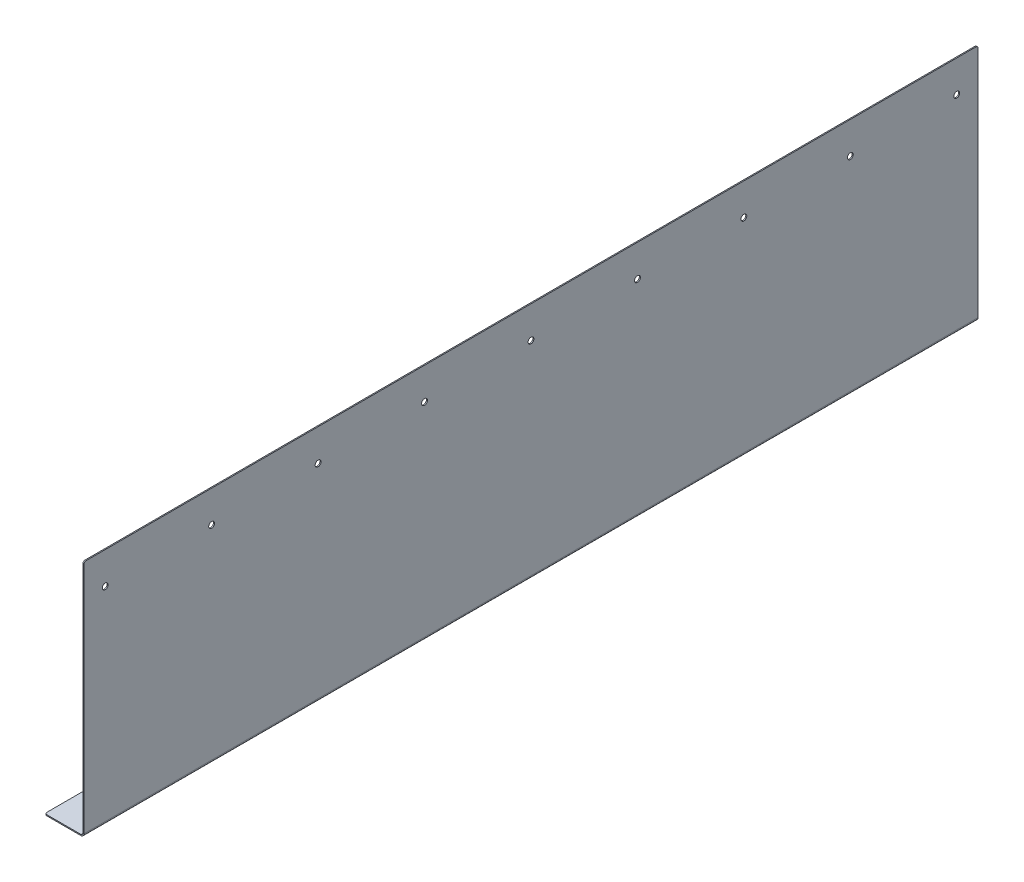
from build123d import *

# Parameters (mm, degrees)
SKETCH2_W                    = 1
SKETCH2_H                    = 225
BASE_FLANGE1_DEPTH           = 421.5
EDGE_FLANGE1_STRIP_W         = 8
EDGE_FLANGE1_STRIP_H         = 1
EDGE_FLANGE1_STRIP_CUT_DEPTH = 843
EDGE_FLANGE1_DEPTH           = 843
CRVPATTERN1_COUNT            = 9
CRVPATTERN1_PITCH            = 100.375
FILLET1_R                    = 2


# Sheet-metal steps are written as plain solids
with BuildPart() as part:
    # Sketch2 → Base-Flange1 (new, symmetric)
    with BuildSketch(Plane.XY):
        with Locations((0.5, 112.5)):
            Rectangle(SKETCH2_W, SKETCH2_H)
    extrude(amount=BASE_FLANGE1_DEPTH, both=True)

    # Edge-Flange1 strip (across the edge) → Edge-Flange1 strip cut (cut)
    with BuildSketch(Plane(origin=(0, 0, -421.5), x_dir=(0, 1, 0), z_dir=(0, 0, 1))):
        with Locations((-1, -0.5)):
            Rectangle(EDGE_FLANGE1_STRIP_W, EDGE_FLANGE1_STRIP_H)
    extrude(amount=EDGE_FLANGE1_STRIP_CUT_DEPTH, mode=Mode.SUBTRACT)

    # Edge-Flange1 section (across the edge) → Edge-Flange1 (add)
    with BuildSketch(Plane(origin=(0, 0, -421.5), x_dir=(0, 1, 0), z_dir=(0, 0, 1))):
        with BuildLine():
            Line((0, 2), (0, 36))
            Line((0, 36), (1, 36))
            Line((1, 36), (1, 2))
            ThreePointArc((1, 2), (1.585786438, 0.585786438), (3, 0))
            Line((3, 0), (3, -1))
            ThreePointArc((3, -1), (0.878679656, -0.121320344), (0, 2))
        make_face()
    extrude(amount=EDGE_FLANGE1_DEPTH)

    # Sketch8 → M5 Clearance Hole1 (revolve, cut)
    with BuildSketch(Plane(origin=(0, 195, -401.5), x_dir=(0, 0, 1), z_dir=(0, 1, 0))):
        Polygon((0, 0), (0, 1), (2.75, 1), (2.75, 0.025), (2.775, 0), align=None)
    m5_clearance_hole1 = revolve(axis=Axis((-6.35, 195, -401.5), (1, 0, 0)), mode=Mode.SUBTRACT)

    # CrvPattern1: M5 Clearance Hole1 ×9
    with Locations(*[(0, 0, i * CRVPATTERN1_PITCH) for i in range(1, CRVPATTERN1_COUNT)]):
        add(m5_clearance_hole1, mode=Mode.SUBTRACT)

    # Fillet1
    fillet1_edges = [part.edges().sort_by_distance(p)[0] for p in [
        (-36, 0.5, -421.5),
        (-36, 0.5, 421.5),
        (0.5, 225, -421.5),
        (0.5, 225, 421.5),
    ]]
    fillet(fillet1_edges, radius=FILLET1_R)


solid = part.part
